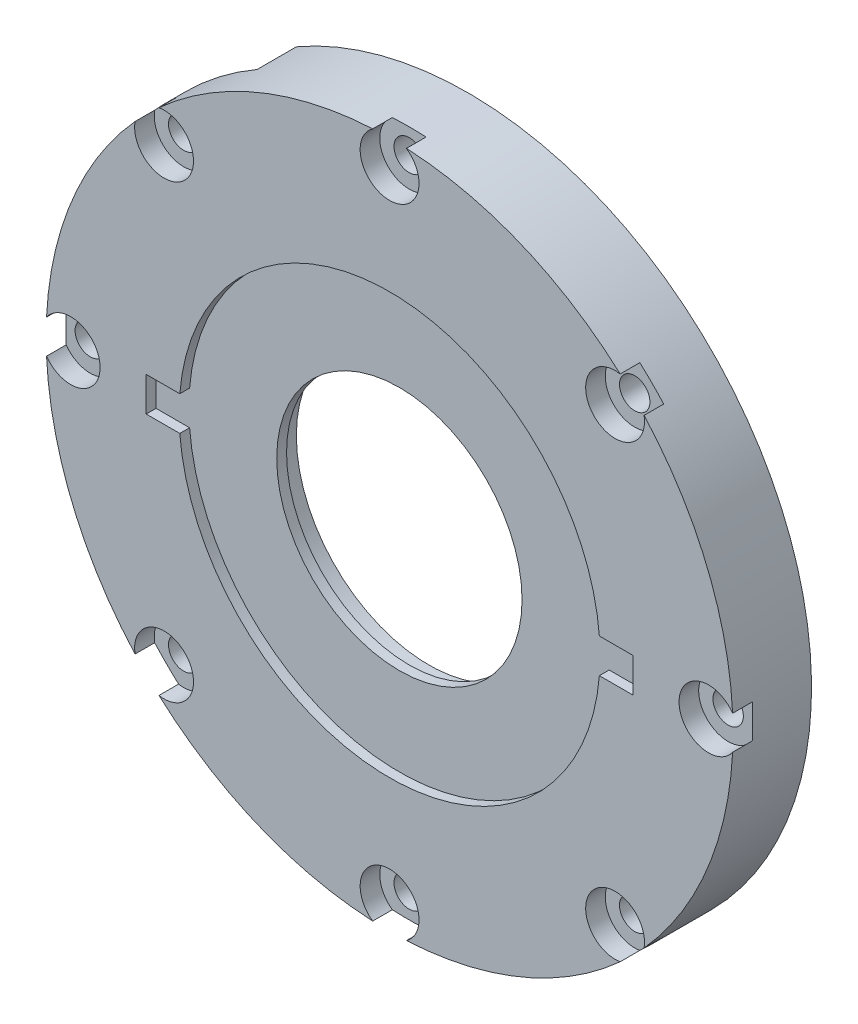
from build123d import *

# Parameters (mm, degrees)
EXTRUDE_1_OUTLINE_R   = 35
EXTRUDE_1_OUTLINE_R_2 = 1.55
EXTRUDE_1_OUTLINE_R_3 = 30.05
EXTRUDE_1_DEPTH       = 10
SKETCH_2_R            = 33.525
SKETCH_2_R_2          = 18.525
EXTRUDE_1_2_DEPTH     = 4
SKETCH_3_R            = 1.55
CUT_EXTRUDE_1_DEPTH   = 51.497524692
CUT_EXTRUDE_2_DEPTH   = 6
SKETCH_8_R            = 35
SKETCH_8_R_2          = 30.05
CUT_EXTRUDE_3_DEPTH   = 2
SKETCH_9_R            = 3
CUT_EXTRUDE_4_DEPTH   = 2
SKETCH_10_R           = 1.55
CUT_EXTRUDE_5_DEPTH   = 51.139804547
SKETCH_11_R           = 3
CUT_EXTRUDE_6_DEPTH   = 2
SKETCH_14_R           = 18.525
SKETCH_14_R_2         = 13.5
EXTRUDE_2_DEPTH       = 4
SKETCH_15_R           = 17.5
CUT_EXTRUDE_8_DEPTH   = 1
SKETCH_17_R           = 17.5
SKETCH_17_R_2         = 12.5
CUT_EXTRUDE_9_DEPTH   = 1
SKETCH1_R             = 13.5
SKETCH1_R_2           = 12
BOSS_EXTRUDE1_DEPTH   = 1
SKETCH2_R             = 12.5
SKETCH2_R_2           = 12
CUT_EXTRUDE1_DEPTH    = 50.989999


# Read off the part's stored shape, not the designer's step: 凸台-拉伸1
with BuildPart() as part:
    # Extrude 1 outline → Extrude 1 (new body)
    with BuildSketch(Plane.XY):
        Circle(EXTRUDE_1_OUTLINE_R)
        with Locations((0, -32.5)):
            Circle(EXTRUDE_1_OUTLINE_R_2, mode=Mode.SUBTRACT)
        with Locations((-32.5, 0)):
            Circle(EXTRUDE_1_OUTLINE_R_2, mode=Mode.SUBTRACT)
        Circle(EXTRUDE_1_OUTLINE_R_3, mode=Mode.SUBTRACT)
        with Locations((32.5, 0)):
            Circle(EXTRUDE_1_OUTLINE_R_2, mode=Mode.SUBTRACT)
        with Locations((0, 32.5)):
            Circle(EXTRUDE_1_OUTLINE_R_2, mode=Mode.SUBTRACT)
    extrude(amount=EXTRUDE_1_DEPTH)

    # 草图2 → Extrude 1 2 (add)
    with BuildSketch(Plane.XY.offset(10)):
        Circle(SKETCH_2_R)
        Circle(SKETCH_2_R_2, mode=Mode.SUBTRACT)
    extrude(amount=-EXTRUDE_1_2_DEPTH)

    # 草图3 → 切除-拉伸1 (cut, through all)
    with BuildSketch(Plane(origin=(0, 0, 0), x_dir=(-1, 0, 0), z_dir=(0, 0, -1))):
        with Locations(Location((32.5, 0, 0), (0, 0, 180))):
            Circle(SKETCH_3_R)
        with Locations(Location((0, -32.5, 0), (0, 0, 180))):
            Circle(SKETCH_3_R)
        with Locations(Location((-32.5, 0, 0), (0, 0, 180))):
            Circle(SKETCH_3_R)
        with Locations(Location((0, 32.5, 0), (0, 0, 180))):
            Circle(SKETCH_3_R)
    extrude(amount=-CUT_EXTRUDE_1_DEPTH, mode=Mode.SUBTRACT)

    # 草图7 → 切除-拉伸2 (cut)
    with BuildSketch(Plane(origin=(0, 0, 0), x_dir=(-1, 0, 0), z_dir=(0, 0, -1))):
        with BuildLine():
            Line((15.025, 26.024063384), (17.5, 30.310889132))
            ThreePointArc((17.5, 30.310889132), (24.748737342, 24.748737342), (30.310889132, 17.5))
            Line((30.310889132, 17.5), (26.024063384, 15.025))
            ThreePointArc((26.024063384, 15.025), (21.248558775, 21.248558775), (15.025, 26.024063384))
        make_face()
    extrude(amount=-CUT_EXTRUDE_2_DEPTH, mode=Mode.SUBTRACT)

    # 草图8 → 切除-拉伸3 (cut)
    with BuildSketch(Plane(origin=(0, 0, 0), x_dir=(-1, 0, 0), z_dir=(0, 0, -1))):
        with Locations(Location((0, 0, 0), (0, 0, 30))):
            Circle(SKETCH_8_R)
        Circle(SKETCH_8_R_2, mode=Mode.SUBTRACT)
    extrude(amount=-CUT_EXTRUDE_3_DEPTH, mode=Mode.SUBTRACT)

    # 草图9 → 切除-拉伸4 (cut)
    with BuildSketch(Plane.XY.offset(10)):
        with Locations((0, 32.5)):
            Circle(SKETCH_9_R)
        with Locations((32.5, 0)):
            Circle(SKETCH_9_R)
        with Locations((0, -32.5)):
            Circle(SKETCH_9_R)
        with Locations((-32.5, 0)):
            Circle(SKETCH_9_R)
    extrude(amount=-CUT_EXTRUDE_4_DEPTH, mode=Mode.SUBTRACT)

    # 草图10 → 切除-拉伸5 (cut, through all)
    with BuildSketch(Plane.XY.offset(10)):
        with Locations((22.980970389, 22.980970389)):
            Circle(SKETCH_10_R)
        with Locations((22.980970389, -22.980970389)):
            Circle(SKETCH_10_R)
        with Locations((-22.980970389, -22.980970389)):
            Circle(SKETCH_10_R)
        with Locations((-22.980970389, 22.980970389)):
            Circle(SKETCH_10_R)
    extrude(amount=-CUT_EXTRUDE_5_DEPTH, mode=Mode.SUBTRACT)

    # 草图11 → 切除-拉伸6 (cut)
    with BuildSketch(Plane.XY.offset(10)):
        with Locations((22.980970389, 22.980970389)):
            Circle(SKETCH_11_R)
        with Locations((22.980970389, -22.980970389)):
            Circle(SKETCH_11_R)
        with Locations((-22.980970389, -22.980970389)):
            Circle(SKETCH_11_R)
        with Locations((-22.980970389, 22.980970389)):
            Circle(SKETCH_11_R)
    extrude(amount=-CUT_EXTRUDE_6_DEPTH, mode=Mode.SUBTRACT)

    # 草图14 → 凸台-拉伸2 (add)
    with BuildSketch(Plane.XY.offset(10)):
        Circle(SKETCH_14_R)
        Circle(SKETCH_14_R_2, mode=Mode.SUBTRACT)
    extrude(amount=-EXTRUDE_2_DEPTH)

    # 草图15 → 切除-拉伸8 (cut)
    with BuildSketch(Plane.XY.offset(10)):
        with BuildLine():
            ThreePointArc((21.378493867, 1.75), (0, 21.45), (-21.378493867, 1.75))
            Line((-21.378493866, 1.75), (-24.8, 1.75))
            Line((-24.8, 1.75), (-24.8, -1.75))
            Line((-24.8, -1.75), (-21.378493867, -1.75))
            ThreePointArc((-21.378493867, -1.75), (0, -21.45), (21.378493867, -1.75))
            Line((21.378493867, -1.75), (24.8, -1.75))
            Line((24.8, -1.75), (24.8, 1.75))
            Line((24.8, 1.75), (21.378493867, 1.75))
        make_face()
        Circle(SKETCH_15_R, mode=Mode.SUBTRACT)
    extrude(amount=-CUT_EXTRUDE_8_DEPTH, mode=Mode.SUBTRACT)

    # 草图17 → 切除-拉伸9 (cut)
    with BuildSketch(Plane.XY.offset(10)):
        Circle(SKETCH_17_R)
        Circle(SKETCH_17_R_2, mode=Mode.SUBTRACT)
    extrude(amount=-CUT_EXTRUDE_9_DEPTH, mode=Mode.SUBTRACT)

    # Sketch1 → Boss-Extrude1 (add)
    with BuildSketch(Plane.XY.offset(9)):
        Circle(SKETCH1_R)
        Circle(SKETCH1_R_2, mode=Mode.SUBTRACT)
    extrude(amount=-BOSS_EXTRUDE1_DEPTH)

    # Sketch2 → Cut-Extrude1 (cut, through all)
    with BuildSketch(Plane.XY.offset(9)):
        Circle(SKETCH2_R)
        Circle(SKETCH2_R_2, mode=Mode.SUBTRACT)
    extrude(amount=-CUT_EXTRUDE1_DEPTH, mode=Mode.SUBTRACT)


solid = part.part
